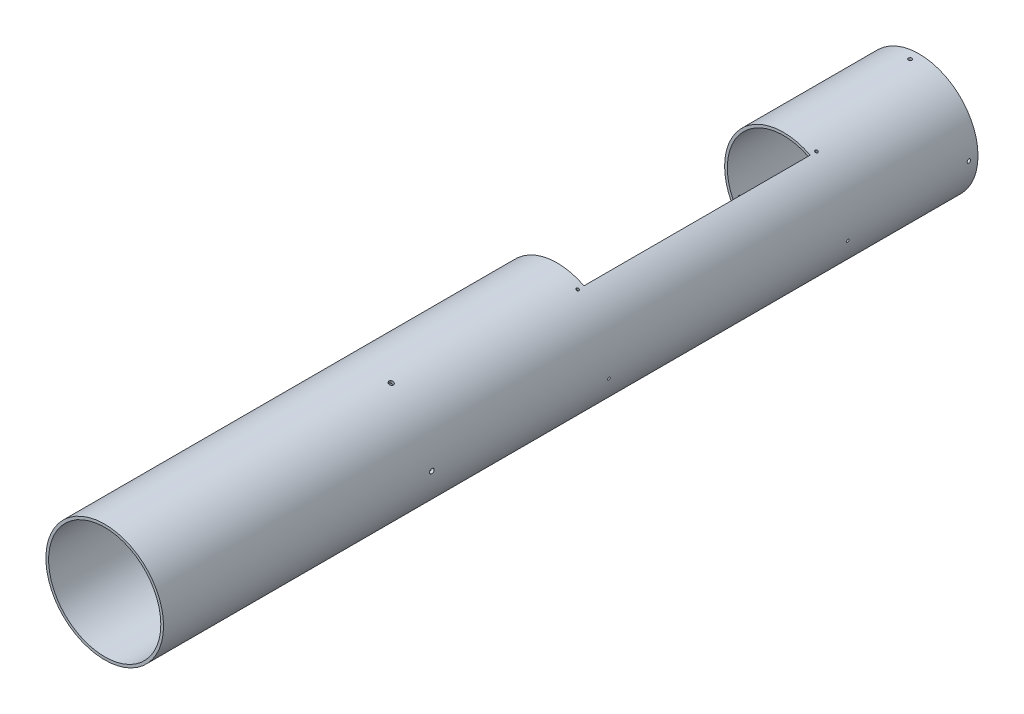
from build123d import *

# Parameters (mm, degrees)
SKETCH1_R           = 65
SKETCH1_R_2         = 62
BOSS_EXTRUDE1_DEPTH = 900
SKETCH4_W           = 130
SKETCH4_H           = 250
CUT_EXTRUDE4_DEPTH  = 516
SKETCH5_R           = 2
CUT_EXTRUDE5_DEPTH  = 85
CIRPATTERN1_COUNT   = 4
SKETCH7_R           = 1.5
CUT_EXTRUDE6_DEPTH  = 243
CIRPATTERN2_COUNT   = 5
SKETCH8_R           = 2.5
CUT_EXTRUDE7_DEPTH  = 209
CIRPATTERN3_COUNT   = 5


with BuildPart() as part:
    # Sketch1 → Boss-Extrude1 (new body)
    with BuildSketch(Plane.XY):
        Circle(SKETCH1_R)
        Circle(SKETCH1_R_2, mode=Mode.SUBTRACT)
    extrude(amount=BOSS_EXTRUDE1_DEPTH)

    # Sketch4 → Cut-Extrude4 (cut)
    with BuildSketch(Plane(origin=(-14.142135624, 14.142135624, 0), x_dir=(0.7071067811865477, 0.7071067811865475, 0), z_dir=(-0.7071067811865475, 0.7071067811865477, 0))):
        with Locations((0, -275)):
            Rectangle(SKETCH4_W, SKETCH4_H)
    extrude(amount=CUT_EXTRUDE4_DEPTH, mode=Mode.SUBTRACT)

    # Sketch5 → Cut-Extrude5 (cut)
    with BuildSketch(Plane(origin=(0, 0, 0), x_dir=(1, 0, 0), z_dir=(0, 1, 0))):
        with Locations((0, -10)):
            Circle(SKETCH5_R)
    cut_extrude5 = extrude(amount=-CUT_EXTRUDE5_DEPTH, mode=Mode.SUBTRACT)

    # CirPattern1: Cut-Extrude5 ×4 about axis
    cirpattern1_axis = Axis((0, 0, 900), (0, 0, -1))
    for i in range(1, CIRPATTERN1_COUNT):
        add(cut_extrude5.rotate(cirpattern1_axis, i * 360 / CIRPATTERN1_COUNT), mode=Mode.SUBTRACT)

    # Sketch7 → Cut-Extrude6 (cut)
    with BuildSketch(Plane(origin=(-14.142135624, 14.142135624, 0), x_dir=(0.7071067811865477, 0.7071067811865475, 0), z_dir=(-0.7071067811865475, 0.7071067811865477, 0))):
        with Locations((0, -143)):
            Circle(SKETCH7_R)
        with Locations((0, -407)):
            Circle(SKETCH7_R)
    cut_extrude6 = extrude(amount=CUT_EXTRUDE6_DEPTH, mode=Mode.SUBTRACT)

    # CirPattern2: Cut-Extrude6 ×5 about axis
    cirpattern2_axis = Axis((0, 0, 900), (0, 0, -1))
    for i in range(1, CIRPATTERN2_COUNT):
        add(cut_extrude6.rotate(cirpattern2_axis, i * 360 / CIRPATTERN2_COUNT), mode=Mode.SUBTRACT)

    # Sketch8 → Cut-Extrude7 (cut)
    with BuildSketch(Plane(origin=(0, 0, 0), x_dir=(0, 0, -1), z_dir=(1, 0, 0))):
        with Locations((-603.5, 0)):
            Circle(SKETCH8_R)
    cut_extrude7 = extrude(amount=CUT_EXTRUDE7_DEPTH, mode=Mode.SUBTRACT)

    # CirPattern3: Cut-Extrude7 ×5 about axis
    cirpattern3_axis = Axis((0, 0, 900), (0, 0, -1))
    for i in range(1, CIRPATTERN3_COUNT):
        add(cut_extrude7.rotate(cirpattern3_axis, i * 360 / CIRPATTERN3_COUNT), mode=Mode.SUBTRACT)


solid = part.part
